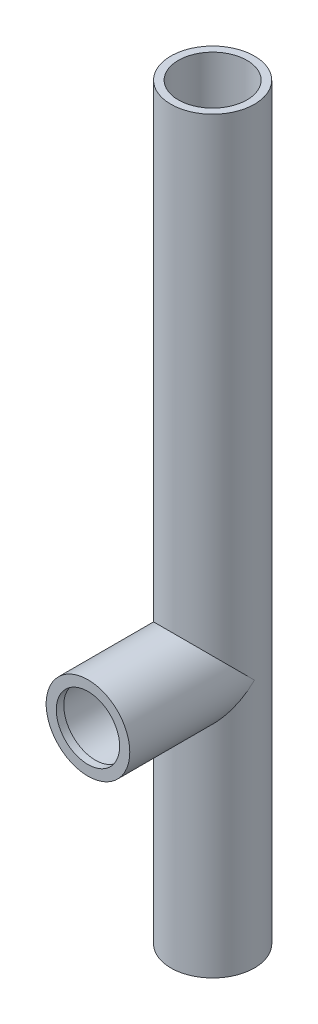
from build123d import *

# Parameters (mm, degrees)
SKETCH1_R           = 16.764
BOSS_EXTRUDE1_DEPTH = 300
SKETCH2_R           = 16.764
BOSS_EXTRUDE2_DEPTH = 50
SHELL1_START        = 3
SHELL1_OUTLINE_R    = 13.764
SHELL1_DEPTH        = 297
SHELL1_START_2      = -1e-07
SHELL1_2_OUTLINE_R  = 13.764
SHELL1_2_DEPTH      = 47.0000001
SKETCH3_R           = 12.7
CUT_EXTRUDE1_DEPTH  = 20
SKETCH4_R           = 13.764
CUT_EXTRUDE2_DEPTH  = 302.645539824


with BuildPart() as part:
    # Sketch1 → Boss-Extrude1 (new body)
    with BuildSketch(Plane(origin=(0, 0, 0), x_dir=(1, 0, 0), z_dir=(0, 1, 0))):
        with Locations(Location((0, 0, 0), (0, 0, 270))):
            Circle(SKETCH1_R)
    extrude(amount=BOSS_EXTRUDE1_DEPTH)

    # Sketch2 → Boss-Extrude2 (add)
    with BuildSketch(Plane.XY):
        with Locations((0, 100)):
            Circle(SKETCH2_R)
    extrude(amount=BOSS_EXTRUDE2_DEPTH)

    # Shell1: read off the stored shape, not the designer's step
    # Shell1 outline → Shell1 (cut)
    with BuildSketch(Plane(origin=(0, 0, 0), x_dir=(1, 0, 0), z_dir=(0, 1, 0)).offset(SHELL1_START)):
        Circle(SHELL1_OUTLINE_R)
    extrude(amount=SHELL1_DEPTH, mode=Mode.SUBTRACT)

    # Shell1 2 outline → Shell1 2 (cut)
    with BuildSketch(Plane.XY.offset(SHELL1_START_2)):
        with Locations((0, 100)):
            Circle(SHELL1_2_OUTLINE_R)
    extrude(amount=SHELL1_2_DEPTH, mode=Mode.SUBTRACT)

    # Sketch3 → Cut-Extrude1 (cut)
    with BuildSketch(Plane.XY.offset(50)):
        with Locations((0, 100)):
            Circle(SKETCH3_R)
    extrude(amount=-CUT_EXTRUDE1_DEPTH, mode=Mode.SUBTRACT)

    # Sketch4 → Cut-Extrude2 (cut, through all)
    with BuildSketch(Plane(origin=(0, 3, 0), x_dir=(1, 0, 0), z_dir=(0, 1, 0))):
        with Locations(Location((0, 0, 0), (0, 0, 270))):
            Circle(SKETCH4_R)
    extrude(amount=-CUT_EXTRUDE2_DEPTH, mode=Mode.SUBTRACT)


solid = part.part
